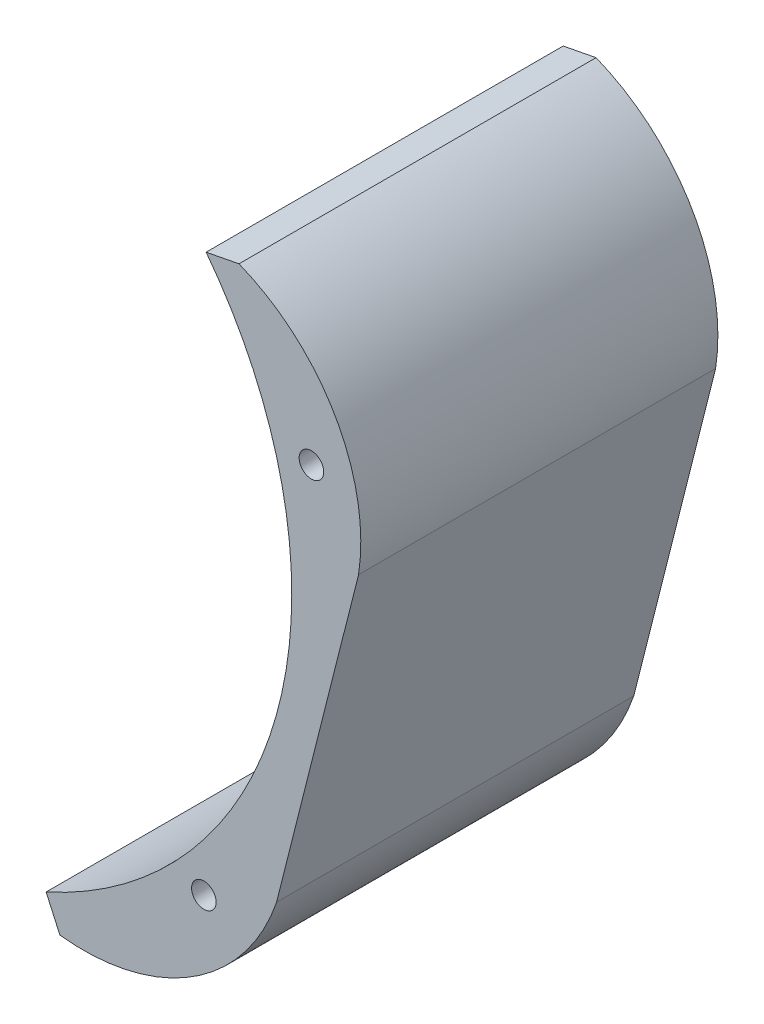
from build123d import *

# Parameters (mm, degrees)
DODANIE_WYCI_GNI_CIE1_DEPTH = 32
SZKIC2_R                    = 1.099999996
SZKIC2_R_2                  = 1.1
WYTNIJ_WYCI_GNI_CIE1_DEPTH  = 2420.505592977


with BuildPart() as part:
    # Szkic1 → Dodanie-wyciągnięcie1 (new body)
    with BuildSketch(Plane.XY):
        with BuildLine():
            Line((2217.006347026, 843.736627995), (2218.242500906, 841.003146043))
            ThreePointArc((2218.242500906, 841.003146043), (2230.117196649, 843.714033588), (2237.663223306, 853.275141889))
            Line((2237.663223306, 853.275141889), (2245.00306314, 882.36339985))
            ThreePointArc((2245.00306314, 882.36339985), (2242.922299371, 893.616147111), (2234.290410693, 901.129095708))
            Line((2234.290410693, 901.129095708), (2231.344755393, 900.560663778))
            ThreePointArc((2231.344755393, 900.560663778), (2237.881232906, 868.690291365), (2217.006347026, 843.736627995))
        make_face()
    extrude(amount=DODANIE_WYCI_GNI_CIE1_DEPTH)

    # Szkic2 → Wytnij-wyciągnięcie1 (cut, through all)
    with BuildSketch(Plane(origin=(0, 0, 0), x_dir=(-1, 0, 0), z_dir=(0, 0, -1))):
        with Locations((-2240.781114995, 888.768038394)):
            Circle(SZKIC2_R)
        with Locations((-2231.140585347, 850.55952738)):
            Circle(SZKIC2_R_2)
    extrude(amount=-WYTNIJ_WYCI_GNI_CIE1_DEPTH, mode=Mode.SUBTRACT)


solid = part.part
